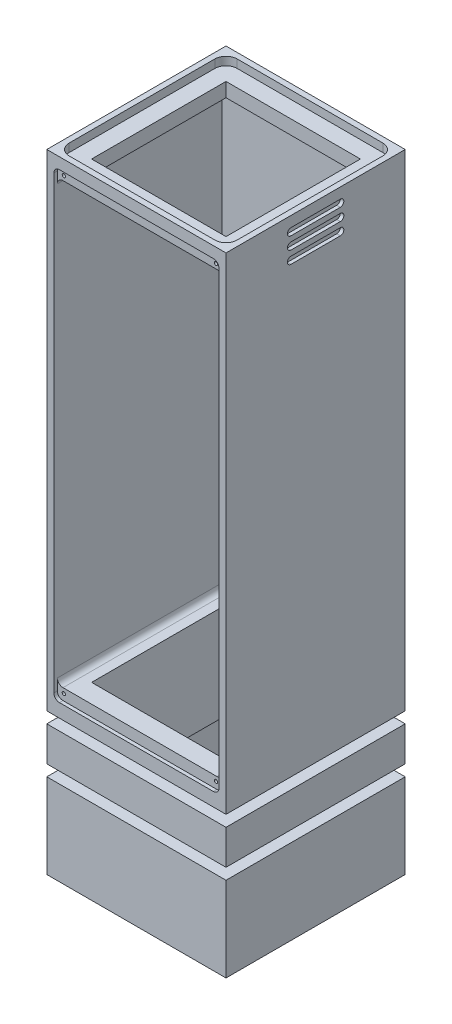
from build123d import *

# Parameters (mm, degrees)
SKETCH1_W                    = 50.8
SKETCH1_H                    = 50.8
SKETCH1_W_2                  = 38.1
SKETCH1_H_2                  = 38.1
BOSS_EXTRUDE1_DEPTH          = 178
SKETCH2_W                    = 44.8
SKETCH2_H                    = 44.8
SKETCH2_W_2                  = 38.1
SKETCH2_H_2                  = 38.1
CUT_EXTRUDE1_DEPTH           = 20
SKETCH3_W                    = 46.8
SKETCH3_H                    = 124.475000116
CUT_EXTRUDE2_DEPTH           = 47.625
SKETCH4_W                    = 50.8
SKETCH4_H                    = 3.175
CUT_EXTRUDE3_DEPTH           = 3.175
SKETCH5_W                    = 3.175
SKETCH5_H                    = 3.175
CUT_EXTRUDE4_DEPTH           = 192.951243809
CUT_EXTRUDE5_DEPTH           = 1
SKETCH7_W                    = 46.8
SKETCH7_H                    = 3.175
CUT_EXTRUDE6_DEPTH           = 1
FILLET1_R                    = 1.5875
CUT_EXTRUDE7_DEPTH           = 2.34442
M1_2X0_25_TAPPED_HOLE1_D     = 0.95
M1_2X0_25_TAPPED_HOLE1_DEPTH = 2.9997
M1_2X0_25_TAPPED_HOLE1_TIP   = 0.285408794


with BuildPart() as part:
    # Sketch1 → Boss-Extrude1 (new body)
    with BuildSketch(Plane(origin=(0, 0, 0), x_dir=(1, 0, 0), z_dir=(0, 1, 0))):
        with Locations((25.4, 25.4)):
            Rectangle(SKETCH1_W, SKETCH1_H)
        with Locations((25.4, 25.4)):
            Rectangle(SKETCH1_W_2, SKETCH1_H_2, mode=Mode.SUBTRACT)
    extrude(amount=BOSS_EXTRUDE1_DEPTH)

    # Sketch2 → Cut-Extrude1 (cut)
    with BuildSketch(Plane.XZ):
        with Locations((25.4, -25.4)):
            Rectangle(SKETCH2_W, SKETCH2_H)
        with Locations((25.4, -25.4)):
            Rectangle(SKETCH2_W_2, SKETCH2_H_2, mode=Mode.SUBTRACT)
    extrude(amount=-CUT_EXTRUDE1_DEPTH, mode=Mode.SUBTRACT)

    # Sketch3 → Cut-Extrude2 (cut)
    with BuildSketch(Plane.XY):
        with Locations((25.4, 109.412499942)):
            Rectangle(SKETCH3_W, SKETCH3_H)
    extrude(amount=-CUT_EXTRUDE2_DEPTH, mode=Mode.SUBTRACT)

    # Sketch4 → Cut-Extrude3 (cut)
    with BuildSketch(Plane.XY):
        with Locations((25.4, 25.5875)):
            Rectangle(SKETCH4_W, SKETCH4_H)
        with Locations((25.4, 38.5875)):
            Rectangle(SKETCH4_W, SKETCH4_H)
    cut_extrude3 = extrude(amount=-CUT_EXTRUDE3_DEPTH, mode=Mode.SUBTRACT)

    # Sketch5 → Cut-Extrude4 (cut, through all)
    with BuildSketch(Plane.XY):
        with Locations((1.5875, 38.5875)):
            Rectangle(SKETCH5_W, SKETCH5_H)
        with Locations((1.5875, 25.5875)):
            Rectangle(SKETCH5_W, SKETCH5_H)
    cut_extrude4 = extrude(amount=-CUT_EXTRUDE4_DEPTH, mode=Mode.SUBTRACT)

    # Sketch6 → Cut-Extrude5 (cut)
    with BuildSketch(Plane.ZY):
        with BuildLine():
            Line((-32.4, 175), (-18.4, 175))
            ThreePointArc((-18.4, 175), (-17.4, 174), (-18.4, 173))
            Line((-18.4, 173), (-32.4, 173))
            ThreePointArc((-32.4, 173), (-33.4, 174), (-32.4, 175))
        make_face()
        with BuildLine():
            Line((-32.4, 171.5), (-18.4, 171.5))
            ThreePointArc((-18.4, 171.5), (-17.4, 170.5), (-18.4, 169.5))
            Line((-18.4, 169.5), (-32.4, 169.5))
            ThreePointArc((-32.4, 169.5), (-33.4, 170.5), (-32.4, 171.5))
        make_face()
        with BuildLine():
            Line((-32.4, 168), (-18.4, 168))
            ThreePointArc((-18.4, 168), (-17.4, 167), (-18.4, 166))
            Line((-18.4, 166), (-32.4, 166))
            ThreePointArc((-32.4, 166), (-33.4, 167), (-32.4, 168))
        make_face()
    cut_extrude5 = extrude(amount=-CUT_EXTRUDE5_DEPTH, mode=Mode.SUBTRACT)

    # Mirror1: Cut-Extrude3 across plane
    add(cut_extrude3.mirror(Plane.XY.offset(-25.4)), mode=Mode.SUBTRACT)

    # Mirror2: Cut-Extrude4, Cut-Extrude5 across plane
    add(cut_extrude4.mirror(Plane.ZY.offset(-25.4)), mode=Mode.SUBTRACT)
    add(cut_extrude5.mirror(Plane.ZY.offset(-25.4)), mode=Mode.SUBTRACT)

    # Sketch7 → Cut-Extrude6 (cut)
    with BuildSketch(Plane.XY):
        with Locations((25.4, 173.2375)):
            Rectangle(SKETCH7_W, SKETCH7_H)
        with Locations((25.4, 45.587499884)):
            Rectangle(SKETCH7_W, SKETCH7_H)
    extrude(amount=-CUT_EXTRUDE6_DEPTH, mode=Mode.SUBTRACT)

    # Fillet1
    fillet1_edges = [part.edges().sort_by_distance(p)[0] for p in [
        (47.8, 10, -47.8),
        (47.8, 10, -3),
        (3, 10, -47.8),
        (3, 10, -3),
        (48.8, 47.174999884, -24.3125),
        (2, 47.174999884, -24.3125),
        (48.8, 171.65, -24.3125),
        (2, 171.65, -24.3125),
        (48.8, 174.825, -0.5),
        (2, 174.825, -0.5),
        (48.8, 43.999999884, -0.5),
        (2, 43.999999884, -0.5),
    ]]
    fillet(fillet1_edges, radius=FILLET1_R)

    # Sketch8 → Cut-Extrude7 (cut)
    with BuildSketch(Plane(origin=(0, 178, 0), x_dir=(1, 0, 0), z_dir=(0, 1, 0))):
        with BuildLine():
            Line((4.7625, 49.2125), (46.0375, 49.2125))
            ThreePointArc((46.0375, 49.2125), (48.28256403, 48.28256403), (49.2125, 46.0375))
            Line((49.2125, 46.0375), (49.2125, 4.7625))
            ThreePointArc((49.2125, 4.7625), (48.28256403, 2.51743597), (46.0375, 1.5875))
            Line((46.0375, 1.5875), (4.7625, 1.5875))
            ThreePointArc((4.7625, 1.5875), (2.51743597, 2.51743597), (1.5875, 4.7625))
            Line((1.5875, 4.7625), (1.5875, 46.0375))
            ThreePointArc((1.5875, 46.0375), (2.51743597, 48.28256403), (4.7625, 49.2125))
        make_face()
    extrude(amount=-CUT_EXTRUDE7_DEPTH, mode=Mode.SUBTRACT)

    # M1.2x0.25 Tapped Hole1
    with Locations(Plane.XY.offset(-1)):
        with Locations((3.8415, 172.98375321), (46.95875321, 172.98375321), (3.8415, 45.841499884), (46.95875321, 45.841499884)):
            Hole(M1_2X0_25_TAPPED_HOLE1_D / 2, depth=M1_2X0_25_TAPPED_HOLE1_DEPTH)
            with Locations((0, 0, -(M1_2X0_25_TAPPED_HOLE1_DEPTH + M1_2X0_25_TAPPED_HOLE1_TIP / 2))):  # 118° drill point
                Cone(0, M1_2X0_25_TAPPED_HOLE1_D / 2, M1_2X0_25_TAPPED_HOLE1_TIP, mode=Mode.SUBTRACT)


solid = part.part
